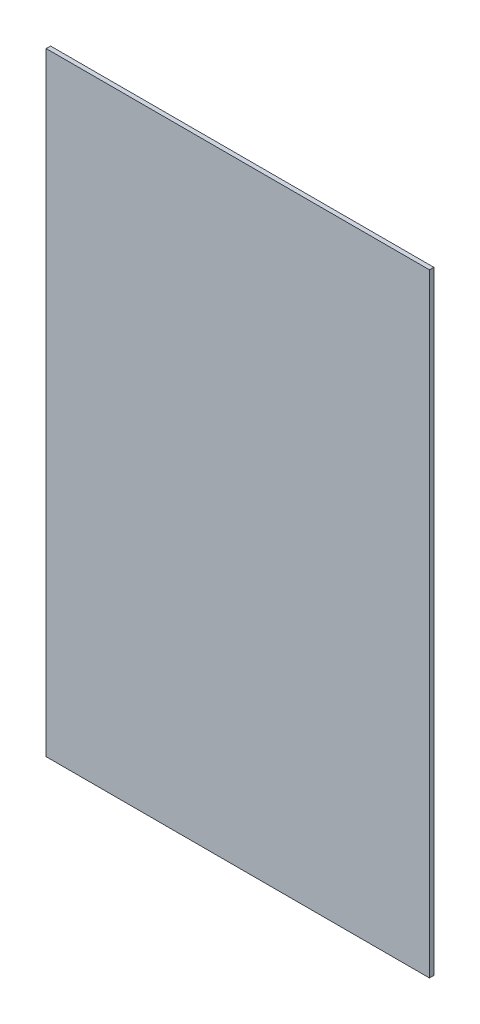
from build123d import *

# Parameters (mm, degrees)
SKETCH1_W          = 79.375
SKETCH1_H          = 127
BASE_FLANGE1_DEPTH = 0.91186


# Sheet-metal steps are written as plain solids
with BuildPart() as part:
    # Sketch1 → Base-Flange1 (new body)
    with BuildSketch(Plane.XY):
        Rectangle(SKETCH1_W, SKETCH1_H)
    extrude(amount=-BASE_FLANGE1_DEPTH)


solid = part.part
